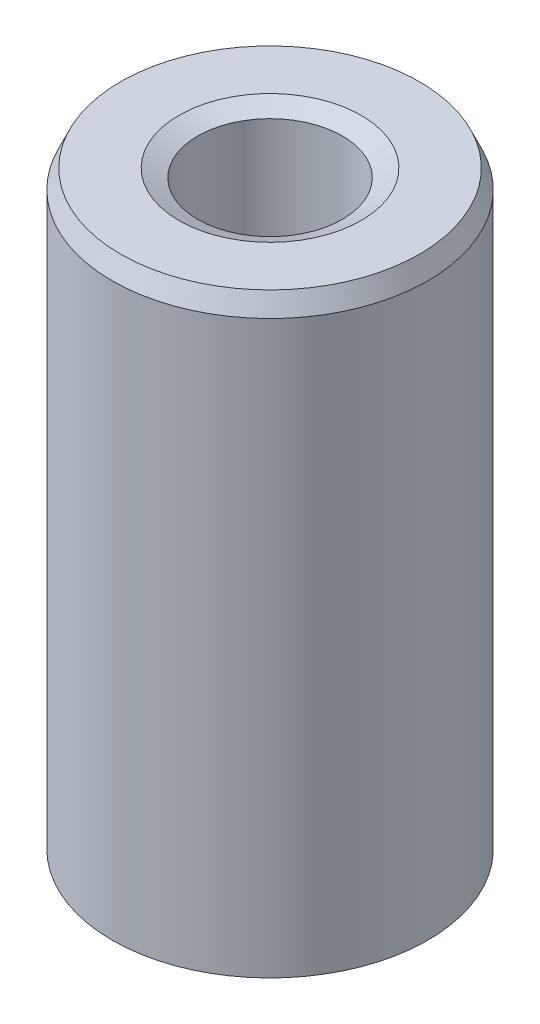
from build123d import *
from OCP.BRepFilletAPI import BRepFilletAPI_MakeChamfer

# Parameters (mm, degrees)
SKETCH1_R           = 12.5
BOSS_EXTRUDE1_DEPTH = 47.382635183
SKETCH2_R           = 5.726229994
CUT_EXTRUDE1_DEPTH  = 51.572859489
CHAMFER1_SIZE       = 1.490738082
CHAMFER1_SIZE2      = 0.666853231


with BuildPart() as part:
    # Sketch1 → Boss-Extrude1 (new body)
    with BuildSketch(Plane(origin=(0, 0, 0), x_dir=(1, 0, 0), z_dir=(0, 1, 0))):
        Circle(SKETCH1_R)
    extrude(amount=BOSS_EXTRUDE1_DEPTH)

    # Sketch2 → Cut-Extrude1 (cut, through all)
    with BuildSketch(Plane(origin=(0, 0, 0), x_dir=(1, 0, 0), z_dir=(0, 1, 0))):
        Circle(SKETCH2_R)
    extrude(amount=CUT_EXTRUDE1_DEPTH, mode=Mode.SUBTRACT)

    # Chamfer1: one chamfer whose edges measure the first distance from different faces: ONE call of the kernel's chamfer builder (chamfer() names one face for all edges)
    chamfer1_edges_1 = [part.edges().sort_by_distance(p)[0] for p in [
        (-5.726229994, 47.382635183, 0),
    ]]
    chamfer1_side_1 = [part.faces().sort_by_distance(p)[0] for p in [
        (-12.146446609, 47.382635183, 0),
    ]]
    chamfer1_edges_2 = [part.edges().sort_by_distance(p)[0] for p in [
        (-5.726229994, 0, 0),
    ]]
    chamfer1_side_2 = [part.faces().sort_by_distance(p)[0] for p in [
        (-5.726229994, 23.691317592, 0),
    ]]
    chamfer1_edges_3 = [part.edges().sort_by_distance(p)[0] for p in [
        (-12.5, 0, 0),
    ]]
    chamfer1_side_3 = [part.faces().sort_by_distance(p)[0] for p in [
        (-12.146446609, 0, 0),
    ]]
    chamfer1_edges_4 = [part.edges().sort_by_distance(p)[0] for p in [
        (-12.5, 47.382635183, 0),
    ]]
    chamfer1_side_4 = [part.faces().sort_by_distance(p)[0] for p in [
        (-12.5, 23.691317592, 0),
    ]]
    chamfer1 = BRepFilletAPI_MakeChamfer(part.part.solid().wrapped)
    for e in chamfer1_edges_1:
        chamfer1.Add(CHAMFER1_SIZE, CHAMFER1_SIZE2, e.wrapped, chamfer1_side_1[0].wrapped)  # the first distance lies on this face
    for e in chamfer1_edges_2:
        chamfer1.Add(CHAMFER1_SIZE, CHAMFER1_SIZE2, e.wrapped, chamfer1_side_2[0].wrapped)  # the first distance lies on this face
    for e in chamfer1_edges_3:
        chamfer1.Add(CHAMFER1_SIZE, CHAMFER1_SIZE2, e.wrapped, chamfer1_side_3[0].wrapped)  # the first distance lies on this face
    for e in chamfer1_edges_4:
        chamfer1.Add(CHAMFER1_SIZE, CHAMFER1_SIZE2, e.wrapped, chamfer1_side_4[0].wrapped)  # the first distance lies on this face
    add(Compound.cast(chamfer1.Shape()), mode=Mode.REPLACE)


solid = part.part
